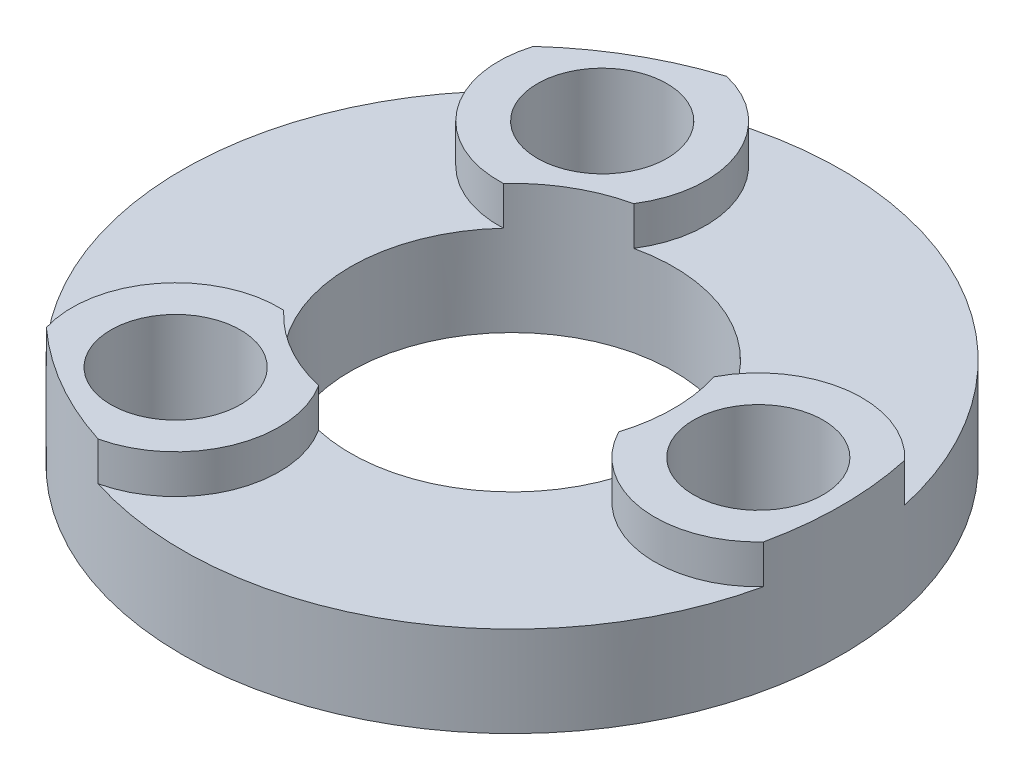
from build123d import *

# Parameters (mm, degrees)
SKETCH1_R           = 25.5
SKETCH1_R_2         = 12.5
BOSS_EXTRUDE1_DEPTH = 10
SKETCH3_R           = 5.0125
CUT_EXTRUDE1_DEPTH  = 7.5
CIRPATTERN1_COUNT   = 3
CUT_EXTRUDE2_START  = -3
CUT_EXTRUDE2_DEPTH  = 3


with BuildPart() as part:
    # Sketch1 → Boss-Extrude1 (new body)
    with BuildSketch(Plane(origin=(0, 0, 0), x_dir=(1, 0, 0), z_dir=(0, 1, 0))):
        Circle(SKETCH1_R)
        Circle(SKETCH1_R_2, mode=Mode.SUBTRACT)
    extrude(amount=BOSS_EXTRUDE1_DEPTH)

    # Sketch3 → Cut-Extrude1 (cut)
    with BuildSketch(Plane(origin=(0, 10, 0), x_dir=(1, 0, 0), z_dir=(0, 1, 0))):
        with Locations((19.0525, 0)):
            Circle(SKETCH3_R)
    cut_extrude1 = extrude(amount=-CUT_EXTRUDE1_DEPTH, mode=Mode.SUBTRACT)

    # CirPattern1: Cut-Extrude1 ×3 about axis
    cirpattern1_axis = Axis((0, 0, 0), (0, 1, 0))
    for i in range(1, CIRPATTERN1_COUNT):
        add(cut_extrude1.rotate(cirpattern1_axis, i * 360 / CIRPATTERN1_COUNT), mode=Mode.SUBTRACT)

    # Sketch6 → Cut-Extrude2 (cut)
    with BuildSketch(Plane(origin=(0, 10, 0), x_dir=(1, 0, 0), z_dir=(0, 1, 0)).offset(CUT_EXTRUDE2_START)):
        with BuildLine():
            ThreePointArc((-17.191359035, 18.833671297), (-15.856549647, 11.587977647), (-9.169416643, 8.495398662))
            ThreePointArc((-9.169416643, 8.495398662), (-12.5, 0), (-9.169416643, -8.495398662))
            ThreePointArc((-9.169416643, -8.495398662), (-15.856549647, -11.587977647), (-17.191359035, -18.833671297))
            ThreePointArc((-17.191359035, -18.833671297), (-25.5, 0), (-17.191359035, 18.833671297))
        make_face()
        with BuildLine():
            ThreePointArc((11.941939378, -3.69324842), (17.963757844, -7.938185987), (24.906117307, -5.471318001))
            ThreePointArc((24.906117307, -5.471318001), (12.75, -22.083647797), (-7.714758273, -24.304989298))
            ThreePointArc((-7.714758273, -24.304989298), (-2.107208197, -19.526163634), (-2.772522735, -12.188647082))
            ThreePointArc((-2.772522735, -12.188647082), (6.25, -10.825317547), (11.941939378, -3.69324842))
        make_face()
        with BuildLine():
            ThreePointArc((-2.772522735, 12.188647082), (-2.107208197, 19.526163634), (-7.714758273, 24.304989298))
            ThreePointArc((-7.714758273, 24.304989298), (12.75, 22.083647797), (24.906117307, 5.471318001))
            ThreePointArc((24.906117307, 5.471318001), (17.963757844, 7.938185987), (11.941939378, 3.69324842))
            ThreePointArc((11.941939378, 3.69324842), (6.25, 10.825317547), (-2.772522735, 12.188647082))
        make_face()
    extrude(amount=CUT_EXTRUDE2_DEPTH, mode=Mode.SUBTRACT)


solid = part.part
